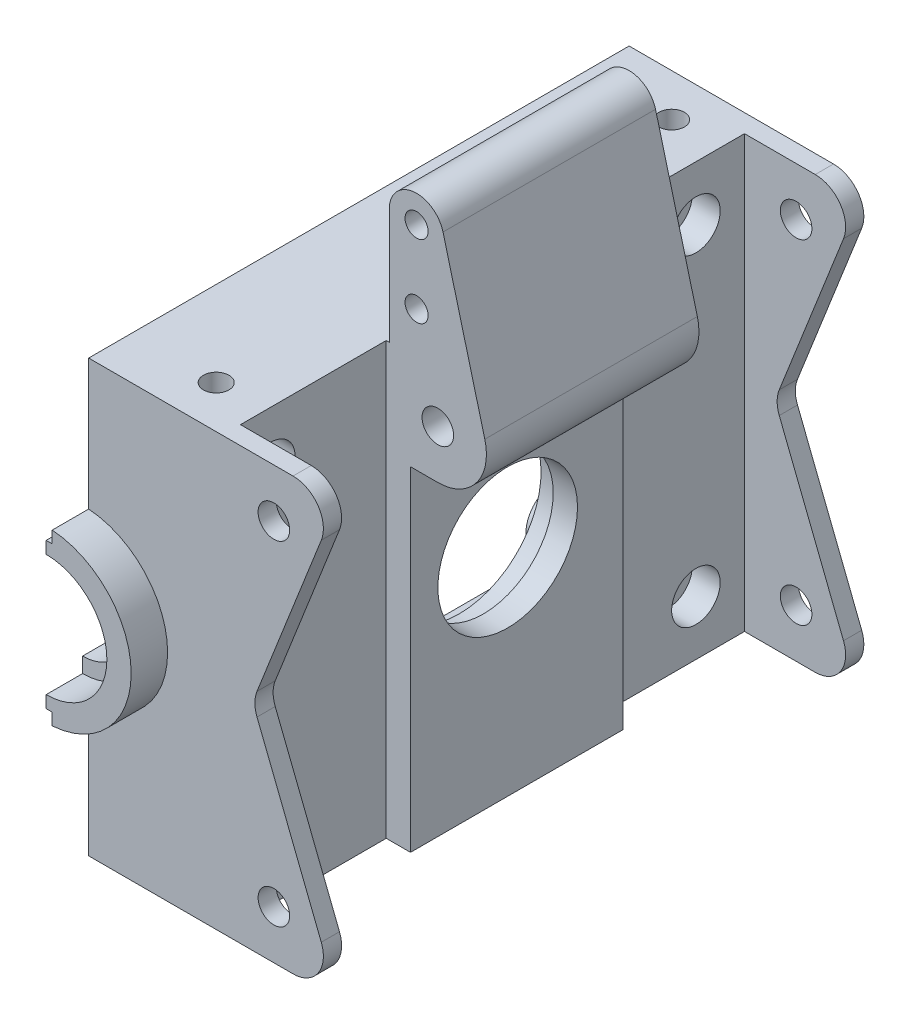
from build123d import *

# Parameters (mm, degrees)
SKETCH_1_W                  = 46
SKETCH_1_H                  = 89
EXTRUDE_1_DEPTH             = 35.5
SKETCH_3_R                  = 2.6
EXTRUDE_2_DEPTH             = 3
EXTRUDE_START               = -3
SKETCH_4_R                  = 2.6
EXTRUDE_3_DEPTH             = 3
SKETCH_5_R                  = 14
EXTRUDE_4_DEPTH             = 6
SKETCH_6_R                  = 11.5
CUT_EXTRUDE_1_DEPTH         = 88.954242748
SKETCH_7_R                  = 2.6
EXTRUDE_5_DEPTH             = 17.5
SKETCH_8_R                  = 1.9
SKETCH_8_R_2                = 4.5
EXTRUDE_6_DEPTH             = 17.5
SKETCH_9_R                  = 2
CUT_EXTRUDE_2_DEPTH         = 115.249255194
SKETCH_10_R                 = 10
CUT_EXTRUDE_3_DEPTH         = 6
SKETCH_11_R                 = 7.5
CUT_EXTRUDE_4_DEPTH         = 6
SKETCH_12_R                 = 9.5
CUT_EXTRUDE_5_DEPTH         = 6
SKETCH_15_W                 = 38
SKETCH_15_H                 = 63
CUT_EXTRUDE_7_DEPTH         = 41
EXTRUDE_START_2             = 9
SKETCH_16_R                 = 14
SKETCH_16_R_2               = 9.5
EXTRUDE_7_DEPTH             = 9
SKETCH_17_R                 = 5
EXTRUDE_10_DEPTH            = 20
EXTRUDE_START_3             = 4
SKETCH_18_W                 = 35
SKETCH_18_H                 = 55
SKETCH_18_R                 = 11.5
EXTRUDE_11_DEPTH            = 4
SKETCH_19_R                 = 13.5
CUT_EXTRUDE_10_DEPTH        = 4
CUT_EXTRUDE_START           = -3.5
SKETCH_20_R                 = 13.5
CUT_EXTRUDE_11_DEPTH        = 3.5
CUT_EXTRUDE_START_2         = -95
CUT_EXTRUDE_15_OUTLINE_R    = 2.6
CUT_EXTRUDE_15_OUTLINE_R_2  = 1.9
CUT_EXTRUDE_15_DEPTH        = 95
HOLE_WIZARD_1_D             = 4.5
HOLE_WIZARD_1_CBORE_D       = 8
HOLE_WIZARD_1_CBORE_DEPTH   = 4.6
CUT_EXTRUDE_16_DEPTH        = 1
HOLE_WIZARD_M5_1_AT_2_COUNT = 2
HOLE_WIZARD_M5_1_AT_2_PITCH = 75
EXTRUDE_12_DEPTH            = 2.5
CUT_EXTRUDE_START_3         = -6.5
SKETCH_32_R                 = 10
CUT_EXTRUDE_17_DEPTH        = 6.5


# Read off the part's stored shape, not the designer's step: 切除-拉伸15
with BuildPart() as part:
    # 草图1 → 凸台-拉伸1 (new, symmetric)
    with BuildSketch(Plane(origin=(0, 0, 0), x_dir=(1, 0, 0), z_dir=(0, 1, 0))):
        Rectangle(SKETCH_1_W, SKETCH_1_H)
    extrude(amount=EXTRUDE_1_DEPTH, both=True)

    # 草图3 → 凸台-拉伸2 (add)
    # profile 1 of 2: a face of its own
    with BuildSketch(Plane.XY.offset(44.5)):
        with BuildLine():
            Line((23, 35.5), (34.653402281, 35.5))
            ThreePointArc((34.653402281, 35.5), (38.786905937, 33.313209471), (39.304766934, 28.66565901))
            Line((39.304766934, 28.66565901), (28.72340208, 1.83434099))
            ThreePointArc((28.72340208, 1.83434099), (28.374766733, 0), (28.72340208, -1.83434099))
            Line((28.72340208, -1.83434099), (39.304766934, -28.66565901))
            ThreePointArc((39.304766934, -28.66565901), (38.786905937, -33.313209471), (34.653402281, -35.5))
            Line((34.653402281, -35.5), (23, -35.5))
            Line((23, -35.5), (23, 35.5))
        make_face()
        with Locations((31.5, 27.5)):
            Circle(SKETCH_3_R, mode=Mode.SUBTRACT)
        with Locations((31.5, -27.5)):
            Circle(SKETCH_3_R, mode=Mode.SUBTRACT)
    # profile 2 of 2: a face of its own
    with BuildSketch(Plane.XY.offset(44.5)):
        with BuildLine():
            Line((-23, -35.5), (-23, 35.5))
            Line((-23, 35.5), (-34.653402281, 35.5))
            ThreePointArc((-34.653402281, 35.5), (-38.786905937, 33.313209471), (-39.304766934, 28.66565901))
            Line((-39.304766934, 28.66565901), (-28.72340208, 1.83434099))
            ThreePointArc((-28.72340208, 1.83434099), (-28.374766733, 0), (-28.72340208, -1.83434099))
            Line((-28.72340208, -1.83434099), (-39.304766934, -28.66565901))
            ThreePointArc((-39.304766934, -28.66565901), (-38.786905937, -33.313209471), (-34.653402281, -35.5))
            Line((-34.653402281, -35.5), (-23, -35.5))
        make_face()
        with Locations((-31.5, -27.5)):
            Circle(SKETCH_3_R, mode=Mode.SUBTRACT)
        with Locations((-31.5, 27.5)):
            Circle(SKETCH_3_R, mode=Mode.SUBTRACT)
    extrude(amount=-EXTRUDE_2_DEPTH)

    # 草图4 → 凸台-拉伸3 (add)
    # profile 1 of 2: a face of its own
    with BuildSketch(Plane(origin=(0, 0, -44.5), x_dir=(-1, 0, 0), z_dir=(0, 0, -1)).offset(EXTRUDE_START)):
        with BuildLine():
            Line((39.304766934, -28.66565901), (28.72340208, -1.83434099))
            ThreePointArc((28.72340208, -1.83434099), (28.374766733, 0), (28.72340208, 1.83434099))
            Line((28.72340208, 1.83434099), (39.304766934, 28.66565901))
            ThreePointArc((39.304766934, 28.66565901), (38.786905937, 33.313209471), (34.653402281, 35.5))
            Line((34.653402281, 35.5), (23, 35.5))
            Line((23, 35.5), (23, -35.5))
            Line((23, -35.5), (34.653402281, -35.5))
            ThreePointArc((34.653402281, -35.5), (38.786905937, -33.313209471), (39.304766934, -28.66565901))
        make_face()
        with Locations(Location((31.5, 27.5, 0), (0, 0, 180))):
            Circle(SKETCH_4_R, mode=Mode.SUBTRACT)
        with Locations(Location((31.5, -27.5, 0), (0, 0, 180))):
            Circle(SKETCH_4_R, mode=Mode.SUBTRACT)
    # profile 2 of 2: a face of its own
    with BuildSketch(Plane(origin=(0, 0, -44.5), x_dir=(-1, 0, 0), z_dir=(0, 0, -1)).offset(EXTRUDE_START)):
        with BuildLine():
            Line((-23, 35.5), (-34.653402281, 35.5))
            ThreePointArc((-34.653402281, 35.5), (-38.786905937, 33.313209471), (-39.304766934, 28.66565901))
            Line((-39.304766934, 28.66565901), (-28.72340208, 1.83434099))
            ThreePointArc((-28.72340208, 1.83434099), (-28.374766733, 0), (-28.72340208, -1.83434099))
            Line((-28.72340208, -1.83434099), (-39.304766934, -28.66565901))
            ThreePointArc((-39.304766934, -28.66565901), (-38.786905937, -33.313209471), (-34.653402281, -35.5))
            Line((-34.653402281, -35.5), (-23, -35.5))
            Line((-23, -35.5), (-23, 35.5))
        make_face()
        with Locations(Location((-31.5, -27.5, 0), (0, 0, 180))):
            Circle(SKETCH_4_R, mode=Mode.SUBTRACT)
        with Locations(Location((-31.5, 27.5, 0), (0, 0, 180))):
            Circle(SKETCH_4_R, mode=Mode.SUBTRACT)
    extrude(amount=EXTRUDE_3_DEPTH)

    # 草图5 → 凸台-拉伸4 (add)
    with BuildSketch(Plane.XY.offset(44.5)):
        Circle(SKETCH_5_R)
    extrude(amount=EXTRUDE_4_DEPTH)

    # 草图6 → 切除-拉伸1 (cut, through all)
    with BuildSketch(Plane(origin=(23, 0, 0), x_dir=(0, 0, -1), z_dir=(1, 0, 0))):
        with Locations((-1.5, 0)):
            Circle(SKETCH_6_R)
    extrude(amount=-CUT_EXTRUDE_1_DEPTH, mode=Mode.SUBTRACT)

    # 草图7 → 凸台-拉伸5 (add, symmetric)
    with BuildSketch(Plane.XY):
        with BuildLine():
            Line((23, 19.5), (23, 35.5))
            Line((23, 35.5), (31.5, 35.5))
            ThreePointArc((31.5, 35.5), (39.5, 27.5), (31.5, 19.5))
            Line((31.5, 19.5), (23, 19.5))
        make_face()
        with Locations((31.5, 27.5)):
            Circle(SKETCH_7_R, mode=Mode.SUBTRACT)
    extrude_5 = extrude(amount=EXTRUDE_5_DEPTH, both=True)

    # 镜向1: 凸台-拉伸5 across plane
    add(extrude_5.mirror(Plane(origin=(0, 0, 0), x_dir=(0, 0, 1), z_dir=(1, 0, 0))))

    # 草图8 → 凸台-拉伸6 (add, symmetric)
    # profile 1 of 2: a face of its own
    with BuildSketch(Plane.XY):
        with BuildLine():
            Line((39.235581788, 29.539797639), (32.351264755, 55.647386172))
            ThreePointArc((32.351264755, 55.647386172), (32.46266128, 55.078493129), (32.5, 54.5))
            ThreePointArc((32.5, 54.5), (28, 50), (23.5, 54.5))
            Line((23.5, 54.5), (23.5, 35.5))
            Line((23.5, 35.5), (31.5, 35.5))
            ThreePointArc((31.5, 35.5), (36.382705136, 33.837127942), (39.235581788, 29.539797639))
        make_face()
        with Locations((28, 42.5)):
            Circle(SKETCH_8_R, mode=Mode.SUBTRACT)
    # profile 2 of 2: a face of its own
    with BuildSketch(Plane.XY):
        with Locations((28, 54.5)):
            Circle(SKETCH_8_R_2)
        with Locations((28, 54.5)):
            Circle(SKETCH_8_R, mode=Mode.SUBTRACT)
    extrude_6 = extrude(amount=EXTRUDE_6_DEPTH, both=True)

    # 镜向2: 凸台-拉伸5, 凸台-拉伸6 across plane
    add(extrude_5.mirror(Plane(origin=(0, 0, 0), x_dir=(0, 0, 1), z_dir=(1, 0, 0))))
    add(extrude_6.mirror(Plane(origin=(0, 0, 0), x_dir=(0, 0, 1), z_dir=(1, 0, 0))))

    # 草图9 → 切除-拉伸2 (cut, through all)
    with BuildSketch(Plane.XZ.offset(35.5)):
        with Locations(Location((15, -37.5, 0), (0, 0, 270))):
            Circle(SKETCH_9_R)
        with Locations(Location((-15, -37.5, 0), (0, 0, 270))):
            Circle(SKETCH_9_R)
        with Locations(Location((-15, 37.5, 0), (0, 0, 270))):
            Circle(SKETCH_9_R)
        with Locations(Location((15, 37.5, 0), (0, 0, 270))):
            Circle(SKETCH_9_R)
    extrude(amount=-CUT_EXTRUDE_2_DEPTH, mode=Mode.SUBTRACT)

    # 草图10 → 切除-拉伸3 (cut)
    with BuildSketch(Plane.XY.offset(50.5)):
        Circle(SKETCH_10_R)
    extrude(amount=-CUT_EXTRUDE_3_DEPTH, mode=Mode.SUBTRACT)

    # 草图11 → 切除-拉伸4 (cut)
    with BuildSketch(Plane.XY.offset(44.5)):
        Circle(SKETCH_11_R)
    extrude(amount=-CUT_EXTRUDE_4_DEPTH, mode=Mode.SUBTRACT)

    # 草图12 → 切除-拉伸5 (cut)
    with BuildSketch(Plane.XY.offset(38.5)):
        Circle(SKETCH_12_R)
    extrude(amount=-CUT_EXTRUDE_5_DEPTH, mode=Mode.SUBTRACT)

    # 草图15 → 切除-拉伸7 (cut, symmetric)
    with BuildSketch(Plane.XY):
        Rectangle(SKETCH_15_W, SKETCH_15_H)
    extrude(amount=CUT_EXTRUDE_7_DEPTH, both=True, mode=Mode.SUBTRACT)

    # 草图16 → 凸台-拉伸7 (add)
    # profile 1 of 3: a face of its own
    with BuildSketch(Plane(origin=(0, 0, 41), x_dir=(-1, 0, 0), z_dir=(0, 0, -1)).offset(EXTRUDE_START_2)):
        with Locations(Location((0, 0, 0), (0, 0, 180))):
            Circle(SKETCH_16_R)
        Circle(SKETCH_16_R_2, mode=Mode.SUBTRACT)
    # profile 2 of 3: a face of its own
    with BuildSketch(Plane(origin=(0, 0, 41), x_dir=(-1, 0, 0), z_dir=(0, 0, -1)).offset(EXTRUDE_START_2)):
        with BuildLine():
            Line((-19, 14), (-19, -14))
            Line((-19, -14), (0, -14))
            ThreePointArc((0, -14), (-14, 0), (0, 14))
            Line((0, 14), (-19, 14))
        make_face()
    # profile 3 of 3: a face of its own
    with BuildSketch(Plane(origin=(0, 0, 41), x_dir=(-1, 0, 0), z_dir=(0, 0, -1)).offset(EXTRUDE_START_2)):
        with BuildLine():
            ThreePointArc((14, 0), (9.899494937, -9.899494937), (0, -14))
            Line((0, -14), (19, -14))
            Line((19, -14), (19, 14))
            Line((19, 14), (0, 14))
            ThreePointArc((0, 14), (9.899494937, 9.899494937), (14, 0))
        make_face()
    extrude(amount=-EXTRUDE_7_DEPTH)

    # 草图17 → 凸台-拉伸10 (add, symmetric)
    with BuildSketch(Plane(origin=(0, 0, 0), x_dir=(0, 0, -1), z_dir=(1, 0, 0))):
        with BuildLine():
            ThreePointArc((-41, 28.679449472), (-39.155442773, 30.736581603), (-36.5, 31.5))
            Line((-36.5, 31.5), (-41, 31.5))
            Line((-41, 31.5), (-41, 28.679449472))
        make_face()
        with BuildLine():
            ThreePointArc((-36.5, 21.5), (-32.964466094, 22.964466094), (-31.5, 26.5))
            ThreePointArc((-31.5, 26.5), (-32.964466094, 30.035533906), (-36.5, 31.5))
            ThreePointArc((-36.5, 31.5), (-39.155442773, 30.736581603), (-41, 28.679449472))
            Line((-41, 28.679449472), (-41, 24.320550528))
            ThreePointArc((-41, 24.320550528), (-39.155442773, 22.263418397), (-36.5, 21.5))
        make_face()
        with BuildLine():
            ThreePointArc((-41, 28.679449472), (-41.5, 26.5), (-41, 24.320550528))
            Line((-41, 24.320550528), (-41, 28.679449472))
        make_face()
        with BuildLine():
            ThreePointArc((-36.5, 31.5), (-32.964466094, 30.035533906), (-31.5, 26.5))
            Line((-31.5, 26.5), (-31.5, 31.5))
            Line((-31.5, 31.5), (-36.5, 31.5))
        make_face()
        with BuildLine():
            Line((-41, 21.5), (-36.5, 21.5))
            ThreePointArc((-36.5, 21.5), (-39.155442773, 22.263418397), (-41, 24.320550528))
            Line((-41, 24.320550528), (-41, 21.5))
        make_face()
        with Locations((33.5, 26.5)):
            Circle(SKETCH_17_R)
        with BuildLine():
            Line((33.5, 31.5), (28.5, 31.5))
            Line((28.5, 31.5), (28.5, 26.5))
            ThreePointArc((28.5, 26.5), (29.964466094, 30.035533906), (33.5, 31.5))
        make_face()
        with BuildLine():
            Line((41, 31.5), (33.5, 31.5))
            ThreePointArc((33.5, 31.5), (37.035533906, 30.035533906), (38.5, 26.5))
            ThreePointArc((38.5, 26.5), (37.035533906, 22.964466094), (33.5, 21.5))
            Line((33.5, 21.5), (41, 21.5))
            Line((41, 21.5), (41, 31.5))
        make_face()
        with Locations((33.5, -26.5)):
            Circle(SKETCH_17_R)
        with BuildLine():
            Line((28.5, -31.5), (33.5, -31.5))
            ThreePointArc((33.5, -31.5), (29.964466094, -30.035533906), (28.5, -26.5))
            Line((28.5, -26.5), (28.5, -31.5))
        make_face()
        with BuildLine():
            Line((41, -31.5), (41, -21.5))
            Line((41, -21.5), (33.5, -21.5))
            ThreePointArc((33.5, -21.5), (37.035533906, -22.964466094), (38.5, -26.5))
            ThreePointArc((38.5, -26.5), (37.035533906, -30.035533906), (33.5, -31.5))
            Line((33.5, -31.5), (41, -31.5))
        make_face()
        with BuildLine():
            Line((-31.5, -31.5), (-31.5, -26.5))
            ThreePointArc((-31.5, -26.5), (-32.964466094, -30.035533906), (-36.5, -31.5))
            Line((-36.5, -31.5), (-31.5, -31.5))
        make_face()
        with BuildLine():
            ThreePointArc((-31.5, -26.5), (-32.964466094, -22.964466094), (-36.5, -21.5))
            ThreePointArc((-36.5, -21.5), (-39.155442773, -22.263418397), (-41, -24.320550528))
            Line((-41, -24.320550528), (-41, -28.679449472))
            ThreePointArc((-41, -28.679449472), (-39.155442773, -30.736581603), (-36.5, -31.5))
            ThreePointArc((-36.5, -31.5), (-32.964466094, -30.035533906), (-31.5, -26.5))
        make_face()
        with BuildLine():
            Line((-41, -28.679449472), (-41, -24.320550528))
            ThreePointArc((-41, -24.320550528), (-41.5, -26.5), (-41, -28.679449472))
        make_face()
        with BuildLine():
            Line((-36.5, -21.5), (-41, -21.5))
            Line((-41, -21.5), (-41, -24.320550528))
            ThreePointArc((-41, -24.320550528), (-39.155442773, -22.263418397), (-36.5, -21.5))
        make_face()
        with BuildLine():
            ThreePointArc((-36.5, -31.5), (-39.155442773, -30.736581603), (-41, -28.679449472))
            Line((-41, -28.679449472), (-41, -31.5))
            Line((-41, -31.5), (-36.5, -31.5))
        make_face()
    extrude(amount=EXTRUDE_10_DEPTH, both=True)

    # 草图18 → 凸台-拉伸11 (add)
    with BuildSketch(Plane(origin=(23, 0, 0), x_dir=(0, 0, -1), z_dir=(1, 0, 0)).offset(EXTRUDE_START_3)):
        with Locations((0, -8)):
            Rectangle(SKETCH_18_W, SKETCH_18_H)
        with Locations((-1.5, 0)):
            Circle(SKETCH_18_R, mode=Mode.SUBTRACT)
    extrude_11 = extrude(amount=-EXTRUDE_11_DEPTH)

    # 镜向3: 凸台-拉伸11 across plane
    add(extrude_11.mirror(Plane(origin=(0, 0, 0), x_dir=(0, 0, 1), z_dir=(1, 0, 0))))

    # 草图19 → 切除-拉伸10 (cut)
    with BuildSketch(Plane.ZY.offset(-19)):
        with Locations(Location((1.5, 0, 0), (0, 0, 270))):
            Circle(SKETCH_19_R)
    extrude(amount=-CUT_EXTRUDE_10_DEPTH, mode=Mode.SUBTRACT)

    # 草图20 → 切除-拉伸11 (cut)
    with BuildSketch(Plane(origin=(-19, 0, 0), x_dir=(0, 0, -1), z_dir=(1, 0, 0)).offset(CUT_EXTRUDE_START)):
        with Locations(Location((-1.5, 0, 0), (0, 0, 270))):
            Circle(SKETCH_20_R)
    extrude(amount=CUT_EXTRUDE_11_DEPTH, mode=Mode.SUBTRACT)

    # 切除-拉伸15 outline → 切除-拉伸15 (cut)
    with BuildSketch(Plane.XY.offset(50.5).offset(CUT_EXTRUDE_START_2)):
        with BuildLine():
            Line((0, 35.5), (-23.5, 35.5))
            Line((-23.5, 35.5), (-23.5, 54.5))
            ThreePointArc((-23.5, 54.5), (-27.421506871, 58.96266128), (-32.351264755, 55.647386172))
            Line((-32.351264755, 55.647386172), (-38.003686406, 34.211549041))
            ThreePointArc((-38.003686406, 34.211549041), (-39.494805436, 31.749326017), (-39.381294029, 28.873027468))
            ThreePointArc((-39.381294029, 28.873027468), (-38.943903734, 24.569420331), (-36.330061997, 21.122657207))
            Line((-36.330061997, 21.122657207), (-28.72340208, 1.83434099))
            ThreePointArc((-28.72340208, 1.83434099), (-28.374766733, 0), (-28.72340208, -1.83434099))
            Line((-28.72340208, -1.83434099), (-39.304766934, -28.66565901))
            ThreePointArc((-39.304766934, -28.66565901), (-38.786905937, -33.313209471), (-34.653402281, -35.5))
            Line((-34.653402281, -35.5), (0, -35.5))
            Line((0, -35.5), (0, 35.5))
        make_face()
        with Locations((-31.5, 27.5)):
            Circle(CUT_EXTRUDE_15_OUTLINE_R, mode=Mode.SUBTRACT)
        with Locations((-31.5, -27.5)):
            Circle(CUT_EXTRUDE_15_OUTLINE_R, mode=Mode.SUBTRACT)
        with Locations((-28, 42.5)):
            Circle(CUT_EXTRUDE_15_OUTLINE_R_2, mode=Mode.SUBTRACT)
        with Locations((-28, 54.5)):
            Circle(CUT_EXTRUDE_15_OUTLINE_R_2, mode=Mode.SUBTRACT)
    extrude(amount=CUT_EXTRUDE_15_DEPTH, mode=Mode.SUBTRACT)

    # 打孔尺寸(%根据)内六角圆柱头螺钉的类型1 (through all)
    with Locations(Plane(origin=(23, 26.5, 36.5), x_dir=(0, 0, 1), z_dir=(1, 0, 0))):
        with Locations((0, 0), (-70, 0), (-70, 53), (0, 53)):
            CounterBoreHole(HOLE_WIZARD_1_D / 2, HOLE_WIZARD_1_CBORE_D / 2, HOLE_WIZARD_1_CBORE_DEPTH)

    # 草图29 → 切除-拉伸16 (cut)
    with BuildSketch(Plane.ZY):
        Polygon((-42.5, -33.5), (42.5, -33.5), (42.5, -12), (50.5, -12), (50.5, -14), (44.5, -14), (44.5, -35.5), (-44.5, -35.5), (-44.5, 35.5), (44.5, 35.5), (44.5, 14), (50.5, 14), (50.5, 12), (42.5, 12), (42.5, 33.5), (-42.5, 33.5), align=None)
    extrude(amount=-CUT_EXTRUDE_16_DEPTH, mode=Mode.SUBTRACT)

    # 草图30 → M5 螺纹孔1 (revolve, cut)
    with BuildSketch(Plane(origin=(15, 35.5, -37.5), x_dir=(0, 0, 1), z_dir=(1, 0, 0))):
        Polygon((0, 0), (0, 11.2618073), (2.1, 10), (2.1, 0), align=None)
    hole_wizard_m5_1 = revolve(axis=Axis((15, 41.85, -37.5), (0, -1, 0)), mode=Mode.SUBTRACT)

    # M5 螺纹孔1 at 2: M5 螺纹孔1 ×2
    with Locations(*[(0, 0, i * HOLE_WIZARD_M5_1_AT_2_PITCH) for i in range(1, HOLE_WIZARD_M5_1_AT_2_COUNT)]):
        add(hole_wizard_m5_1, mode=Mode.SUBTRACT)

    # 镜向4: M5 螺纹孔1 across plane
    add(hole_wizard_m5_1.mirror(Plane.ZX), mode=Mode.SUBTRACT)

    # 镜向4 copy 1 sketch → 镜向4 copy 1 (revolve, cut)
    with BuildSketch(Plane(origin=(15, -35.5, 37.5), x_dir=(0, 0, 1), z_dir=(1, 0, 0))):
        Polygon((0, 0), (0, -11.2618073), (2.1, -10), (2.1, 0), align=None)
    revolve(axis=Axis((15, -41.85, 37.5), (0, -1, 0)), mode=Mode.SUBTRACT)

    # 草图31 → 凸台-拉伸12 (add)
    with BuildSketch(Plane(origin=(0, 0, 41), x_dir=(-1, 0, 0), z_dir=(0, 0, -1))):
        with BuildLine():
            Line((0, 7.5), (0, 9.5))
            ThreePointArc((0, 9.5), (-9.5, 0), (0, -9.5))
            Line((0, -9.5), (0, -7.5))
            ThreePointArc((0, -7.5), (-7.5, 0), (0, 7.5))
        make_face()
    extrude(amount=EXTRUDE_12_DEPTH)

    # 草图32 → 切除-拉伸17 (cut)
    with BuildSketch(Plane(origin=(0, 0, 32), x_dir=(-1, 0, 0), z_dir=(0, 0, -1)).offset(CUT_EXTRUDE_START_3)):
        Circle(SKETCH_32_R)
    extrude(amount=CUT_EXTRUDE_17_DEPTH, mode=Mode.SUBTRACT)


solid = part.part
